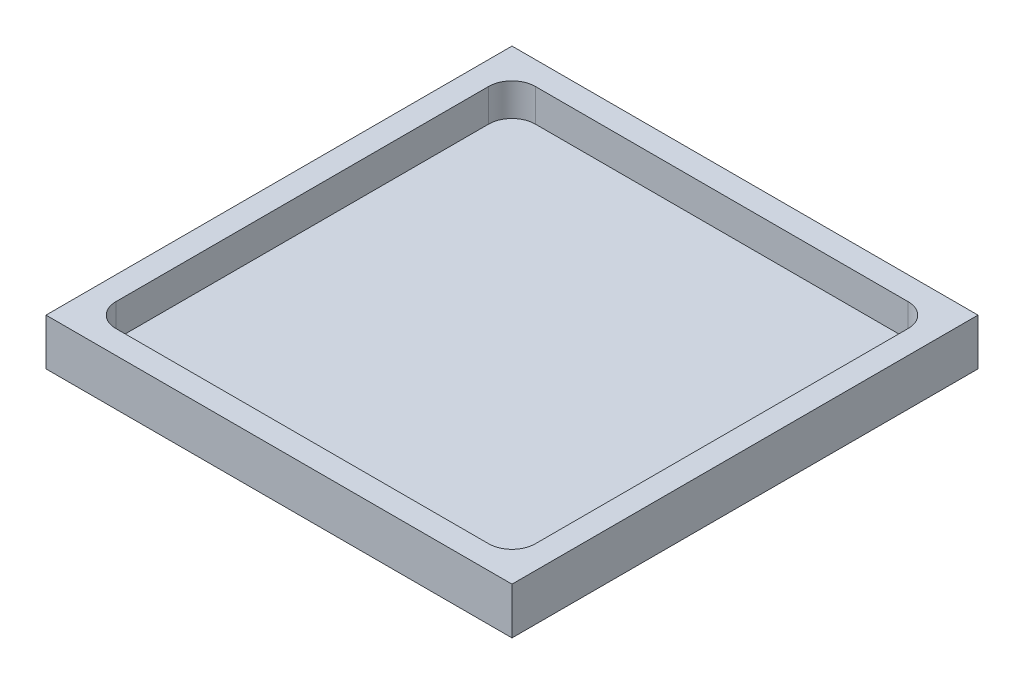
from build123d import *

# Parameters (mm, degrees)
SKETCH2_W           = 100
SKETCH2_H           = 100
BOSS_EXTRUDE1_DEPTH = 10
SKETCH3_W           = 90
SKETCH3_H           = 90
CUT_EXTRUDE1_DEPTH  = 7
FILLET2_R           = 5


with BuildPart() as part:
    # Sketch2 → Boss-Extrude1 (new body)
    with BuildSketch(Plane(origin=(0, 0, 0), x_dir=(1, 0, 0), z_dir=(0, 1, 0))):
        with Locations((50, 50)):
            Rectangle(SKETCH2_W, SKETCH2_H)
    extrude(amount=BOSS_EXTRUDE1_DEPTH)

    # Sketch3 → Cut-Extrude1 (cut)
    with BuildSketch(Plane(origin=(0, 10, 0), x_dir=(1, 0, 0), z_dir=(0, 1, 0))):
        with Locations((50, 50)):
            Rectangle(SKETCH3_W, SKETCH3_H)
    extrude(amount=-CUT_EXTRUDE1_DEPTH, mode=Mode.SUBTRACT)

    # Fillet2
    fillet2_edges = [part.edges().sort_by_distance(p)[0] for p in [
        (95, 6.5, -95),
        (95, 6.5, -5),
        (5, 6.5, -5),
        (5, 6.5, -95),
    ]]
    fillet(fillet2_edges, radius=FILLET2_R)


solid = part.part
